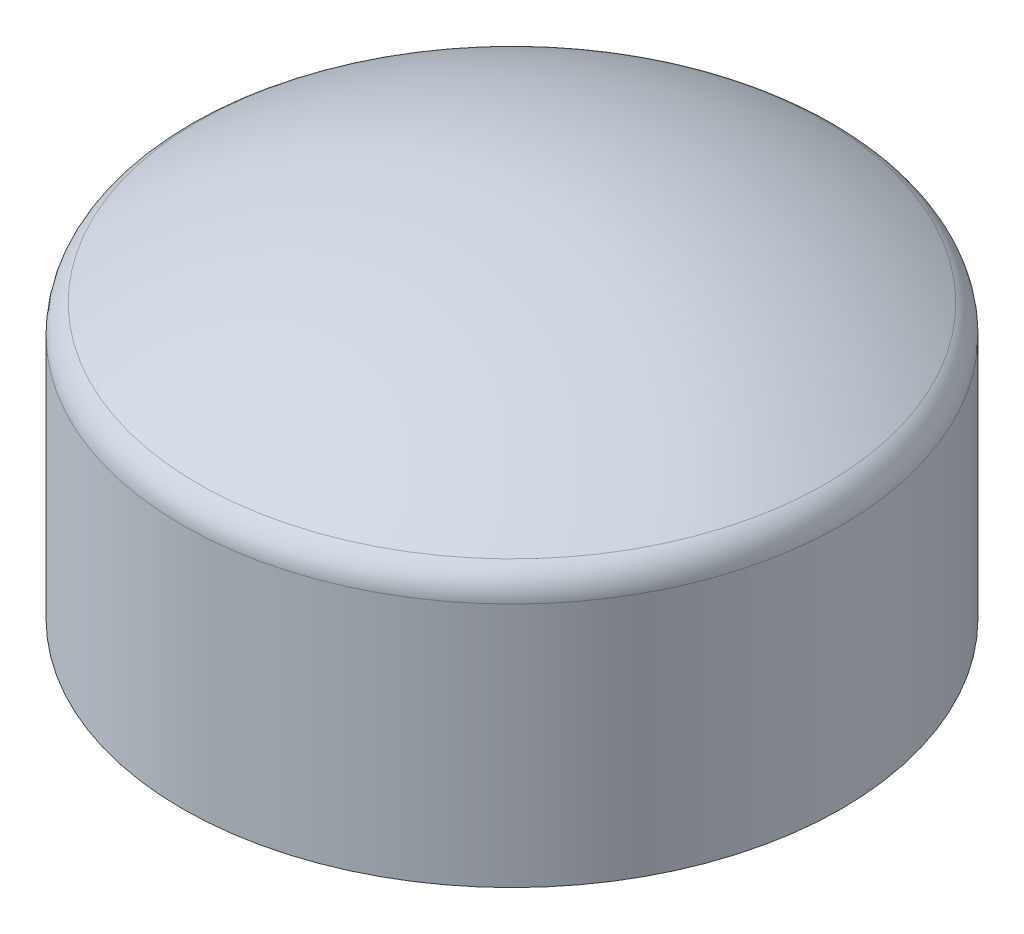
from build123d import *

# Parameters (mm, degrees)
FILLET1_R = 1


with BuildPart() as part:
    # Sketch1 → Revolve1 (revolve)
    with BuildSketch(Plane.XY):
        with BuildLine():
            Line((-8, 0), (-10, 0))
            Line((-10, 0), (-10, 8))
            ThreePointArc((-10, 8), (-5.220153254, 10.233844182), (0, 11))
            Line((0, 11), (0, 7))
            Line((0, 7), (-8, 7))
            Line((-8, 7), (-8, 0))
        make_face()
    revolve(axis=Axis((0, 7, 0), (0, 1, 0)))

    # Fillet1
    fillet1_edges = [part.edges().sort_by_distance(p)[0] for p in [
        (10, 8, 0),
    ]]
    fillet(fillet1_edges, radius=FILLET1_R)


solid = part.part
